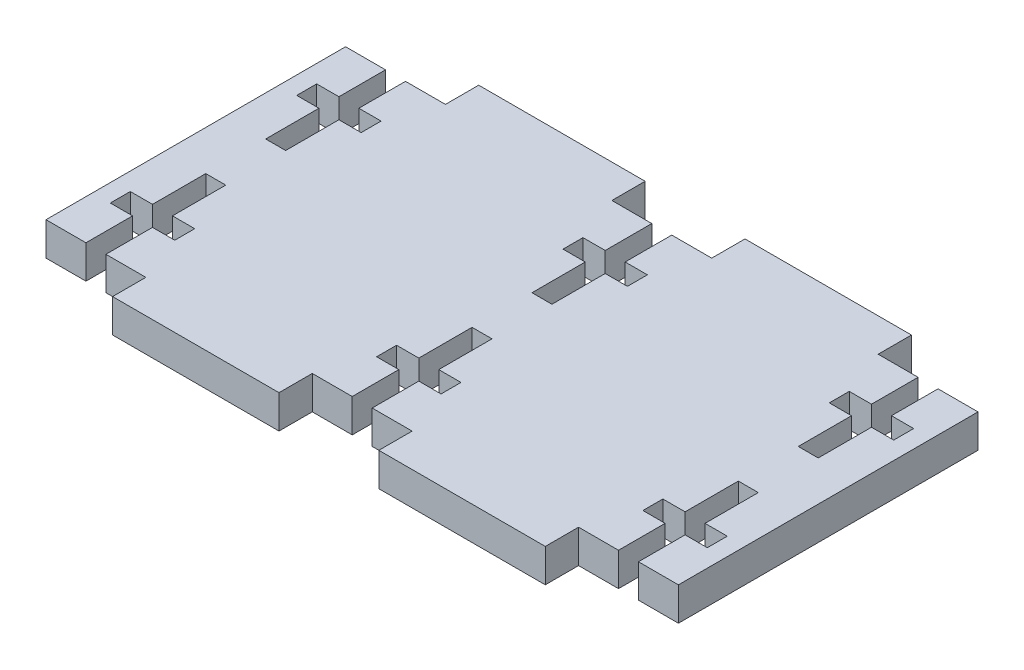
from build123d import *

# Parameters (mm, degrees)
SCHIZZO1_W                   = 95
SCHIZZO1_H                   = 55
ESTRUSIONE_ESTRUSIONE2_DEPTH = 5
SCHIZZO2_W                   = 15
SCHIZZO2_H                   = 5
TAGLIO_ESTRUSIONE1_DEPTH     = 62.661600097
TAGLIO_ESTRUSIONE3_DEPTH     = 62.661600097


with BuildPart() as part:
    # Schizzo1 → Estrusione-Estrusione2 (new body)
    with BuildSketch(Plane(origin=(0, 0, 0), x_dir=(1, 0, 0), z_dir=(0, 1, 0))):
        with Locations((-7.06494914, -0.781075862)):
            Rectangle(SCHIZZO1_W, SCHIZZO1_H)
    extrude(amount=-ESTRUSIONE_ESTRUSIONE2_DEPTH)

    # Schizzo2 → Taglio-Estrusione1 (cut, through all)
    with BuildSketch(Plane(origin=(0, 0, 0), x_dir=(1, 0, 0), z_dir=(0, 1, 0))):
        with Locations((-47.06494914, -25.781075862)):
            Rectangle(SCHIZZO2_W, SCHIZZO2_H)
        with Locations((-47.06494914, 24.218924138)):
            Rectangle(SCHIZZO2_W, SCHIZZO2_H)
        with Locations((32.93505086, -25.781075862)):
            Rectangle(SCHIZZO2_W, SCHIZZO2_H)
        with Locations((32.93505086, 24.218924138)):
            Rectangle(SCHIZZO2_W, SCHIZZO2_H)
        with Locations((-7.06494914, -25.781075862)):
            Rectangle(SCHIZZO2_W, SCHIZZO2_H)
        with Locations((-7.06494914, 24.218924138)):
            Rectangle(SCHIZZO2_W, SCHIZZO2_H)
    extrude(amount=-TAGLIO_ESTRUSIONE1_DEPTH, mode=Mode.SUBTRACT)

    # Schizzo3 → Taglio-Estrusione3 (cut, through all)
    with BuildSketch(Plane(origin=(0, 0, 0), x_dir=(1, 0, 0), z_dir=(0, 1, 0))):
        Polygon((-48.56494914, -23.281075862), (-45.56494914, -23.281075862), (-45.56494914, -16.281075862), (-42.22494914, -16.281075862), (-42.22494914, -13.281075862), (-45.56494914, -13.281075862), (-45.56494914, -5.281075862), (-48.56494914, -5.281075862), (-48.56494914, -13.281075862), (-51.90494914, -13.281075862), (-51.90494914, -16.281075862), (-48.56494914, -16.281075862), align=None)
        Polygon((-8.56494914, -23.281075862), (-5.56494914, -23.281075862), (-5.56494914, -16.281075862), (-2.22494914, -16.281075862), (-2.22494914, -13.281075862), (-5.56494914, -13.281075862), (-5.56494914, -5.281075862), (-8.56494914, -5.281075862), (-8.56494914, -13.281075862), (-11.90494914, -13.281075862), (-11.90494914, -16.281075862), (-8.56494914, -16.281075862), align=None)
        Polygon((31.43505086, -23.281075862), (34.43505086, -23.281075862), (34.43505086, -16.281075862), (37.77505086, -16.281075862), (37.77505086, -13.281075862), (34.43505086, -13.281075862), (34.43505086, -5.281075862), (31.43505086, -5.281075862), (31.43505086, -13.281075862), (28.09505086, -13.281075862), (28.09505086, -16.281075862), (31.43505086, -16.281075862), align=None)
        Polygon((31.43505086, 3.718924138), (34.43505086, 3.718924138), (34.43505086, 11.718924138), (37.77505086, 11.718924138), (37.77505086, 14.718924138), (34.43505086, 14.718924138), (34.43505086, 21.718924138), (31.43505086, 21.718924138), (31.43505086, 14.718924138), (28.09505086, 14.718924138), (28.09505086, 11.718924138), (31.43505086, 11.718924138), align=None)
        Polygon((-8.56494914, 3.718924138), (-5.56494914, 3.718924138), (-5.56494914, 11.718924138), (-2.22494914, 11.718924138), (-2.22494914, 14.718924138), (-5.56494914, 14.718924138), (-5.56494914, 21.718924138), (-8.56494914, 21.718924138), (-8.56494914, 14.718924138), (-11.90494914, 14.718924138), (-11.90494914, 11.718924138), (-8.56494914, 11.718924138), align=None)
        Polygon((-48.56494914, 3.718924138), (-45.56494914, 3.718924138), (-45.56494914, 11.718924138), (-42.22494914, 11.718924138), (-42.22494914, 14.718924138), (-45.56494914, 14.718924138), (-45.56494914, 21.718924138), (-48.56494914, 21.718924138), (-48.56494914, 14.718924138), (-51.90494914, 14.718924138), (-51.90494914, 11.718924138), (-48.56494914, 11.718924138), align=None)
    extrude(amount=-TAGLIO_ESTRUSIONE3_DEPTH, mode=Mode.SUBTRACT)


solid = part.part
